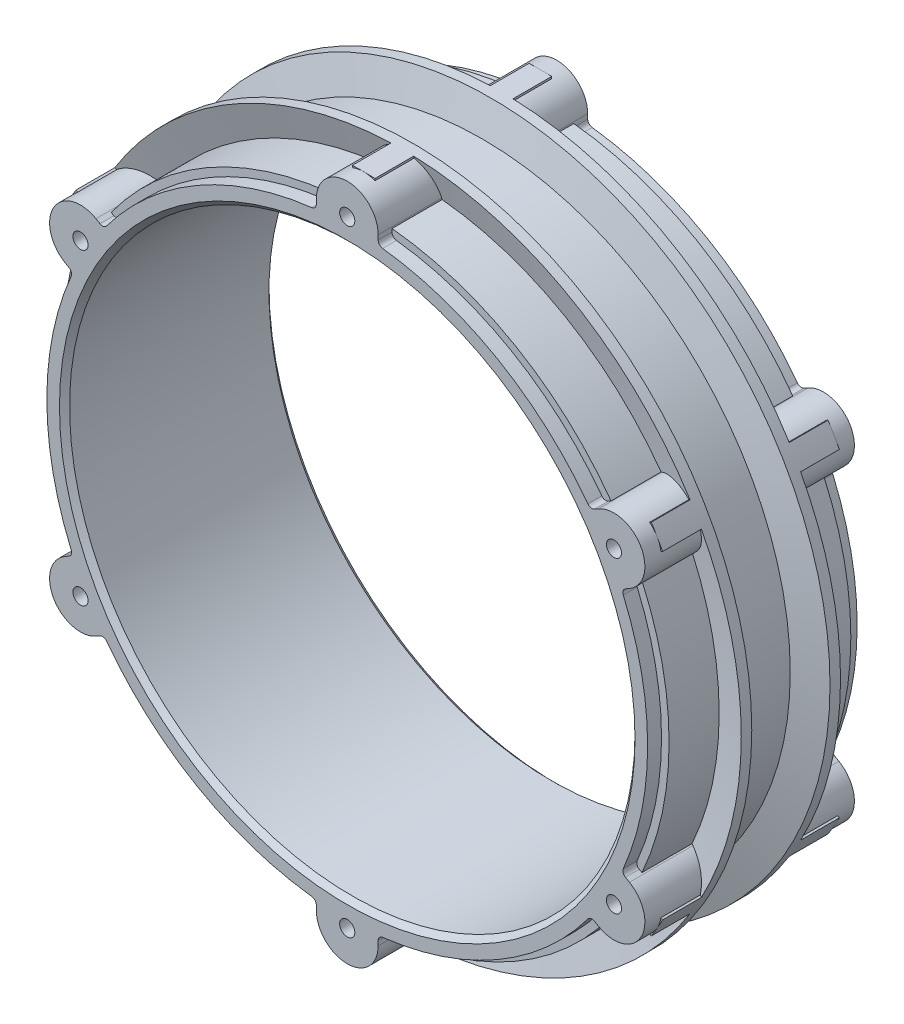
from build123d import *

# Parameters (mm, degrees)
SKETCH1_R               = 56
BOSS_EXTRUDE1_DEPTH     = 20.75
SKETCH4_R               = 61
SKETCH4_R_2             = 59.5
BOSS_EXTRUDE2_DEPTH     = 18
SKETCH3_R               = 1.5
CUT_EXTRUDE1_DEPTH      = 6
CIRPATTERN1_COUNT       = 6
MIRROR1_COPY_1_SKETCH_R = 1.5
MIRROR1_COPY_1_DEPTH    = 6
MIRROR1_COPY_2_SKETCH_R = 1.5
MIRROR1_COPY_2_DEPTH    = 6
MIRROR1_COPY_3_SKETCH_R = 1.5
MIRROR1_COPY_3_DEPTH    = 6
MIRROR1_COPY_4_SKETCH_R = 1.5
MIRROR1_COPY_4_DEPTH    = 6
MIRROR1_COPY_5_SKETCH_R = 1.5
MIRROR1_COPY_5_DEPTH    = 6
SKETCH7_W               = 4.5
SKETCH7_H               = 8.26947797
BOSS_EXTRUDE3_DEPTH     = 17.5
CIRPATTERN2_COUNT       = 6
CHAMFER1_SIZE           = 1


with BuildPart() as part:
    # Sketch1 → Boss-Extrude1 (new, symmetric)
    with BuildSketch(Plane.XY):
        with BuildLine():
            Line((6.125, 60.07898447), (6.125, 61))
            ThreePointArc((6.125, 61), (0, 67.125), (-6.125, 61))
            Line((-6.125, 61), (-6.125, 60.07898447))
            ThreePointArc((-6.125, 60.07898447), (-6.377414354, 59.414819052), (-7.007231405, 59.085943405))
            ThreePointArc((-7.007231405, 59.085943405), (-29.75, 51.528511525), (-47.666312293, 35.611412109))
            ThreePointArc((-47.666312293, 35.611412109), (-48.266035483, 35.230412368), (-48.967426785, 35.343897833))
            Line((-48.967426785, 35.343897833), (-49.765049631, 35.804405598))
            ThreePointArc((-49.765049631, 35.804405598), (-58.131955229, 33.5625), (-55.890049631, 25.195594402))
            Line((-55.890049631, 25.195594402), (-55.092426785, 24.735086637))
            ThreePointArc((-55.092426785, 24.735086637), (-54.643449838, 24.184406685), (-54.673543698, 23.474531296))
            ThreePointArc((-54.673543698, 23.474531296), (-59.5, 0), (-54.673543698, -23.474531296))
            ThreePointArc((-54.673543698, -23.474531296), (-54.643449838, -24.184406685), (-55.092426785, -24.735086637))
            Line((-55.092426785, -24.735086637), (-55.890049631, -25.195594402))
            ThreePointArc((-55.890049631, -25.195594402), (-58.131955229, -33.5625), (-49.765049631, -35.804405598))
            Line((-49.765049631, -35.804405598), (-48.967426785, -35.343897833))
            ThreePointArc((-48.967426785, -35.343897833), (-48.266035483, -35.230412368), (-47.666312293, -35.611412109))
            ThreePointArc((-47.666312293, -35.611412109), (-29.75, -51.528511525), (-7.007231405, -59.085943405))
            ThreePointArc((-7.007231405, -59.085943405), (-6.377414354, -59.414819052), (-6.125, -60.07898447))
            Line((-6.125, -60.07898447), (-6.125, -61))
            ThreePointArc((-6.125, -61), (0, -67.125), (6.125, -61))
            Line((6.125, -61), (6.125, -60.07898447))
            ThreePointArc((6.125, -60.07898447), (6.377414354, -59.414819052), (7.007231405, -59.085943405))
            ThreePointArc((7.007231405, -59.085943405), (29.75, -51.528511525), (47.666312293, -35.611412109))
            ThreePointArc((47.666312293, -35.611412109), (48.266035483, -35.230412368), (48.967426785, -35.343897833))
            Line((48.967426785, -35.343897833), (49.765049631, -35.804405598))
            ThreePointArc((49.765049631, -35.804405598), (58.131955229, -33.5625), (55.890049631, -25.195594402))
            Line((55.890049631, -25.195594402), (55.092426785, -24.735086637))
            ThreePointArc((55.092426785, -24.735086637), (54.643449838, -24.184406685), (54.673543698, -23.474531296))
            ThreePointArc((54.673543698, -23.474531296), (59.5, 0), (54.673543698, 23.474531296))
            ThreePointArc((54.673543698, 23.474531296), (54.643449838, 24.184406685), (55.092426785, 24.735086637))
            Line((55.092426785, 24.735086637), (55.890049631, 25.195594402))
            ThreePointArc((55.890049631, 25.195594402), (58.131955229, 33.5625), (49.765049631, 35.804405598))
            Line((49.765049631, 35.804405598), (48.967426785, 35.343897833))
            ThreePointArc((48.967426785, 35.343897833), (48.266035483, 35.230412368), (47.666312293, 35.611412109))
            ThreePointArc((47.666312293, 35.611412109), (29.75, 51.528511525), (7.007231405, 59.085943405))
            ThreePointArc((7.007231405, 59.085943405), (6.377414354, 59.414819052), (6.125, 60.07898447))
        make_face()
        Circle(SKETCH1_R, mode=Mode.SUBTRACT)
    extrude(amount=BOSS_EXTRUDE1_DEPTH, both=True)

    # Sketch4 → Boss-Extrude2 (add, symmetric)
    with BuildSketch(Plane.XY):
        Circle(SKETCH4_R)
        Circle(SKETCH4_R_2, mode=Mode.SUBTRACT)
    extrude(amount=BOSS_EXTRUDE2_DEPTH, both=True)

    # Sketch3 → Cut-Extrude1 (cut)
    with BuildSketch(Plane(origin=(0, 0, 20.75), x_dir=(-1, 0, 0), z_dir=(0, 0, -1))):
        with Locations((0, 61)):
            Circle(SKETCH3_R)
    cut_extrude1 = extrude(amount=CUT_EXTRUDE1_DEPTH, mode=Mode.SUBTRACT)

    # CirPattern1: Cut-Extrude1 ×6 about axis
    cirpattern1_axis = Axis((0, 0, 20.75), (0, 0, 1))
    for i in range(1, CIRPATTERN1_COUNT):
        add(cut_extrude1.rotate(cirpattern1_axis, i * 360 / CIRPATTERN1_COUNT), mode=Mode.SUBTRACT)

    # Mirror1: Cut-Extrude1 across plane
    add(cut_extrude1.mirror(Plane.XY), mode=Mode.SUBTRACT)

    # Mirror1 copy 1 sketch → Mirror1 copy 1 (cut)
    with BuildSketch(Plane(origin=(0, 0, -20.75), x_dir=(-0.5000000000000001, -0.8660254037844386, 0), z_dir=(0, 0, 1))):
        with Locations((0, -61)):
            Circle(MIRROR1_COPY_1_SKETCH_R)
    extrude(amount=MIRROR1_COPY_1_DEPTH, mode=Mode.SUBTRACT)

    # Mirror1 copy 2 sketch → Mirror1 copy 2 (cut)
    with BuildSketch(Plane(origin=(0, 0, -20.75), x_dir=(0.4999999999999998, -0.8660254037844387, 0), z_dir=(0, 0, 1))):
        with Locations((0, -61)):
            Circle(MIRROR1_COPY_2_SKETCH_R)
    extrude(amount=MIRROR1_COPY_2_DEPTH, mode=Mode.SUBTRACT)

    # Mirror1 copy 3 sketch → Mirror1 copy 3 (cut)
    with BuildSketch(Plane.XY.offset(-20.75)):
        with Locations((0, -61)):
            Circle(MIRROR1_COPY_3_SKETCH_R)
    extrude(amount=MIRROR1_COPY_3_DEPTH, mode=Mode.SUBTRACT)

    # Mirror1 copy 4 sketch → Mirror1 copy 4 (cut)
    with BuildSketch(Plane(origin=(0, 0, -20.75), x_dir=(0.5000000000000004, 0.8660254037844384, 0), z_dir=(0, 0, 1))):
        with Locations((0, -61)):
            Circle(MIRROR1_COPY_4_SKETCH_R)
    extrude(amount=MIRROR1_COPY_4_DEPTH, mode=Mode.SUBTRACT)

    # Mirror1 copy 5 sketch → Mirror1 copy 5 (cut)
    with BuildSketch(Plane(origin=(0, 0, -20.75), x_dir=(-0.5000000000000001, 0.8660254037844386, 0), z_dir=(0, 0, 1))):
        with Locations((0, -61)):
            Circle(MIRROR1_COPY_5_SKETCH_R)
    extrude(amount=MIRROR1_COPY_5_DEPTH, mode=Mode.SUBTRACT)

    # Sketch5 → Revolve1 (revolve)
    with BuildSketch(Plane(origin=(0, 0, 0), x_dir=(0, 0, -1), z_dir=(0, 1, 0))):
        Polygon((-12.080031397, 75), (-10, 75), (-6, 61), (-8.080031397, 61), align=None)
        Polygon((10, 75), (6, 61), (8.080031397, 61), (12.080031397, 75), align=None)
    revolve(axis=Axis((0, 0, 0), (0, 0, 1)))

    # Sketch7 → Boss-Extrude3 (add, symmetric)
    with BuildSketch(Plane.XY):
        with Locations((0, 70.831503418)):
            Rectangle(SKETCH7_W, SKETCH7_H)
    boss_extrude3 = extrude(amount=BOSS_EXTRUDE3_DEPTH, both=True)

    # CirPattern2: Boss-Extrude3 ×6 about axis
    cirpattern2_axis = Axis((0, 0, 20.75), (0, 0, 1))
    for i in range(1, CIRPATTERN2_COUNT):
        add(boss_extrude3.rotate(cirpattern2_axis, i * 360 / CIRPATTERN2_COUNT))

    # Sketch6 → Cut-Revolve1 (revolve, cut)
    with BuildSketch(Plane(origin=(0, 0, 0), x_dir=(1, 0, 0), z_dir=(0, 1, 0))):
        Polygon((-67.125, -7.75), (-61, -6), (-61, 6), (-67.125, 7.75), (-67.125, 20.75), (-75, 20.75), (-75, -20.75), (-67.125, -20.75), align=None)
    revolve(axis=Axis((0, 0, 0), (0, 0, -1)), mode=Mode.SUBTRACT)

    # Chamfer1
    chamfer1_edges = [part.edges().sort_by_distance(p)[0] for p in [
        (-56, 0, -20.75),
        (-56, 0, 20.75),
    ]]
    chamfer(chamfer1_edges, length=CHAMFER1_SIZE)


solid = part.part
